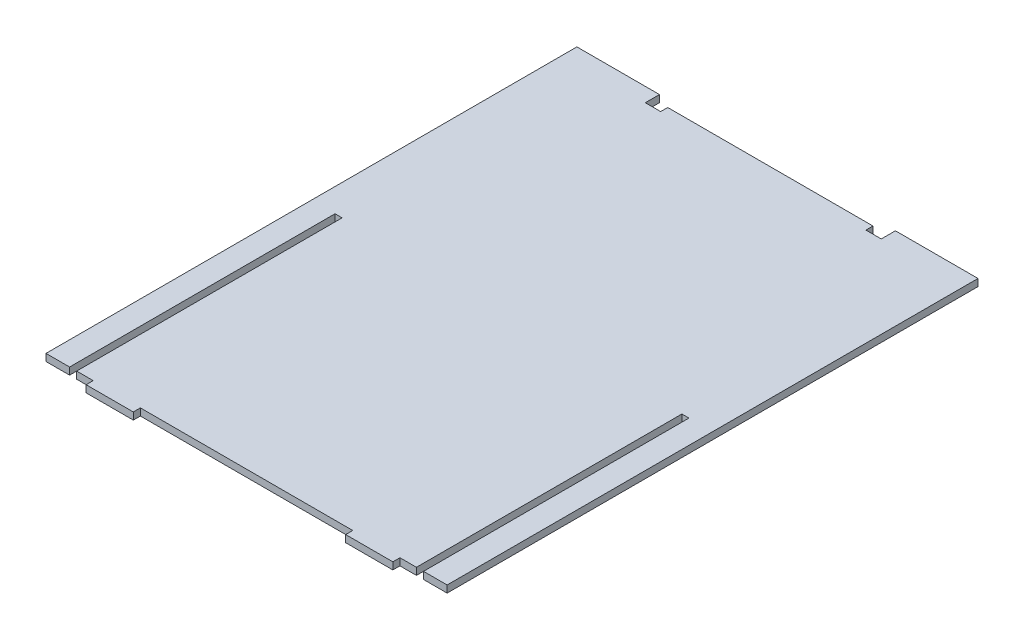
from build123d import *

# Parameters (mm, degrees)
BOSS_EXTRUDE1_DEPTH = 6
SKETCH2_W           = 6
SKETCH2_H           = 225
CUT_EXTRUDE1_DEPTH  = 6
LPATTERN1_COUNT     = 2
LPATTERN1_PITCH     = 294
CUT_EXTRUDE2_DEPTH  = 6


with BuildPart() as part:
    # Sketch1 → Boss-Extrude1 (new body)
    with BuildSketch(Plane(origin=(0, 0, 0), x_dir=(1, 0, 0), z_dir=(0, 1, 0))):
        Polygon((300, 0), (300, -6), (260, -6), (260, 0), (80, 0), (80, -6), (40, -6), (40, 0), (0, 0), (0, 450), (340, 450), (340, 0), align=None)
    extrude(amount=BOSS_EXTRUDE1_DEPTH)

    # Sketch2 → Cut-Extrude1 (cut)
    with BuildSketch(Plane(origin=(0, 6, 0), x_dir=(1, 0, 0), z_dir=(0, 1, 0))):
        with Locations((23, 112.5)):
            Rectangle(SKETCH2_W, SKETCH2_H)
    cut_extrude1 = extrude(amount=-CUT_EXTRUDE1_DEPTH, mode=Mode.SUBTRACT)

    # LPattern1: Cut-Extrude1 ×2
    with Locations(*[(i * LPATTERN1_PITCH, 0, 0) for i in range(1, LPATTERN1_COUNT)]):
        add(cut_extrude1, mode=Mode.SUBTRACT)

    # Sketch3 → Cut-Extrude2 (cut)
    with BuildSketch(Plane(origin=(0, 6, 0), x_dir=(1, 0, 0), z_dir=(0, 1, 0))):
        Polygon((70, 450), (270, 450), (270, 438), (257, 438), (257, 444), (83, 444), (83, 438), (70, 438), align=None)
    extrude(amount=-CUT_EXTRUDE2_DEPTH, mode=Mode.SUBTRACT)


solid = part.part
